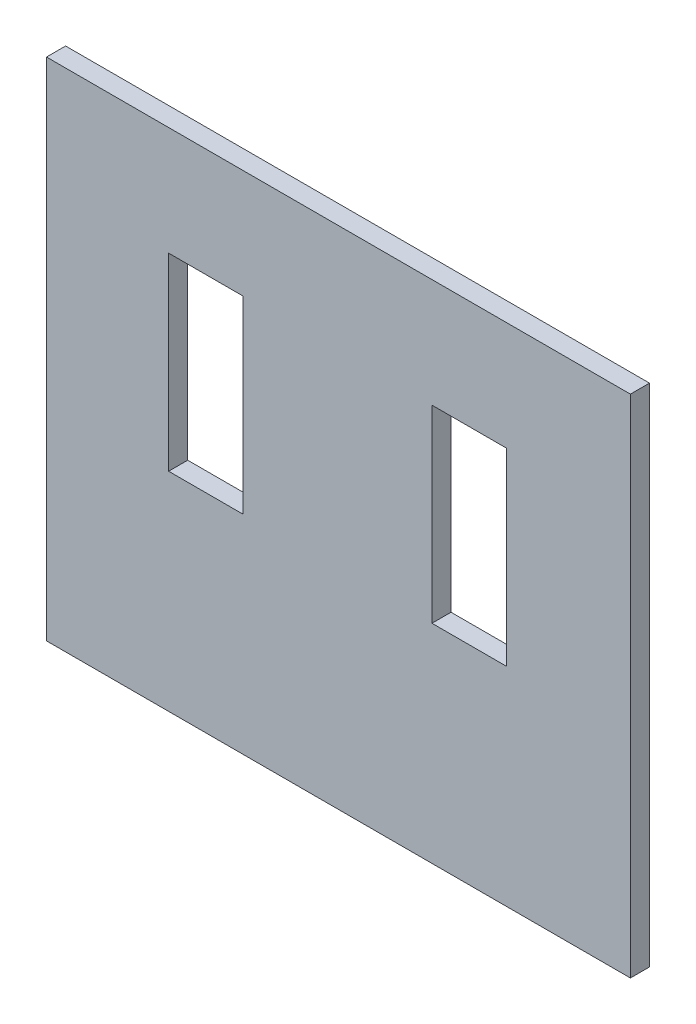
from build123d import *

# Parameters (mm, degrees)
ESBO_O6_W                = 3060
ESBO_O6_H                = 2650
RESSALTO_EXTRUS_O2_DEPTH = 100
ESBO_O7_W                = 390
ESBO_O7_H                = 990
CORTE_EXTRUS_O1_DEPTH    = 749


with BuildPart() as part:
    # Esboço6 → Ressalto-extrusão2 (new body)
    with BuildSketch(Plane.XY):
        with Locations((1530, 1325)):
            Rectangle(ESBO_O6_W, ESBO_O6_H)
    extrude(amount=RESSALTO_EXTRUS_O2_DEPTH)

    # Esboço7 → Corte-extrusão1 (cut)
    with BuildSketch(Plane.XY.offset(100)):
        with Locations((2215, 1585)):
            Rectangle(ESBO_O7_W, ESBO_O7_H)
        with Locations((835, 1585)):
            Rectangle(ESBO_O7_W, ESBO_O7_H)
    extrude(amount=-CORTE_EXTRUS_O1_DEPTH, mode=Mode.SUBTRACT)


solid = part.part
